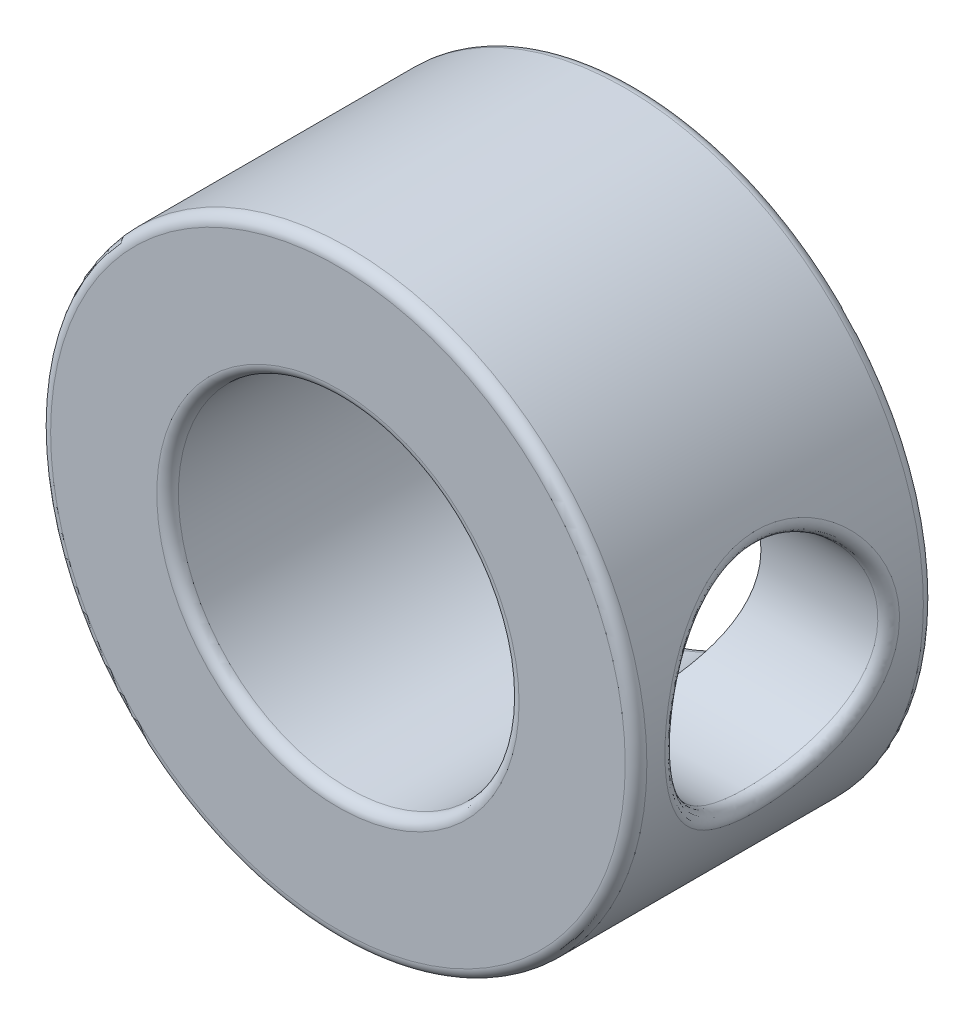
from build123d import *

# Parameters (mm, degrees)
SKETCH2_R           = 7
BOSS_EXTRUDE1_DEPTH = 7
SKETCH3_R           = 4
CUT_EXTRUDE1_DEPTH  = 13.124355653
SKETCH4_R           = 2.499999953
CUT_EXTRUDE2_DEPTH  = 13.124355653
FILLET1_R           = 0.254


with BuildPart() as part:
    # Sketch2 → Boss-Extrude1 (new body)
    with BuildSketch(Plane.XY):
        Circle(SKETCH2_R)
    extrude(amount=BOSS_EXTRUDE1_DEPTH)

    # Sketch3 → Cut-Extrude1 (cut, through all)
    with BuildSketch(Plane.XY.offset(7)):
        Circle(SKETCH3_R)
    extrude(amount=-CUT_EXTRUDE1_DEPTH, mode=Mode.SUBTRACT)

    # Sketch4 → Cut-Extrude2 (cut, through all)
    with BuildSketch(Plane(origin=(0, 0, 0), x_dir=(0, 0, -1), z_dir=(1, 0, 0))):
        with Locations((-3.5687, 0)):
            Circle(SKETCH4_R)
    extrude(amount=CUT_EXTRUDE2_DEPTH, mode=Mode.SUBTRACT)

    # Fillet1
    fillet1_edges = [part.edges().sort_by_distance(p)[0] for p in [
        (-4, 0, 0),
        (-7, 0, 0),
        (6.538348433, 2.499999953, 3.5687),
        (-4, 0, 7),
        (-7, 0, 7),
    ]]
    fillet(fillet1_edges, radius=FILLET1_R)


solid = part.part
